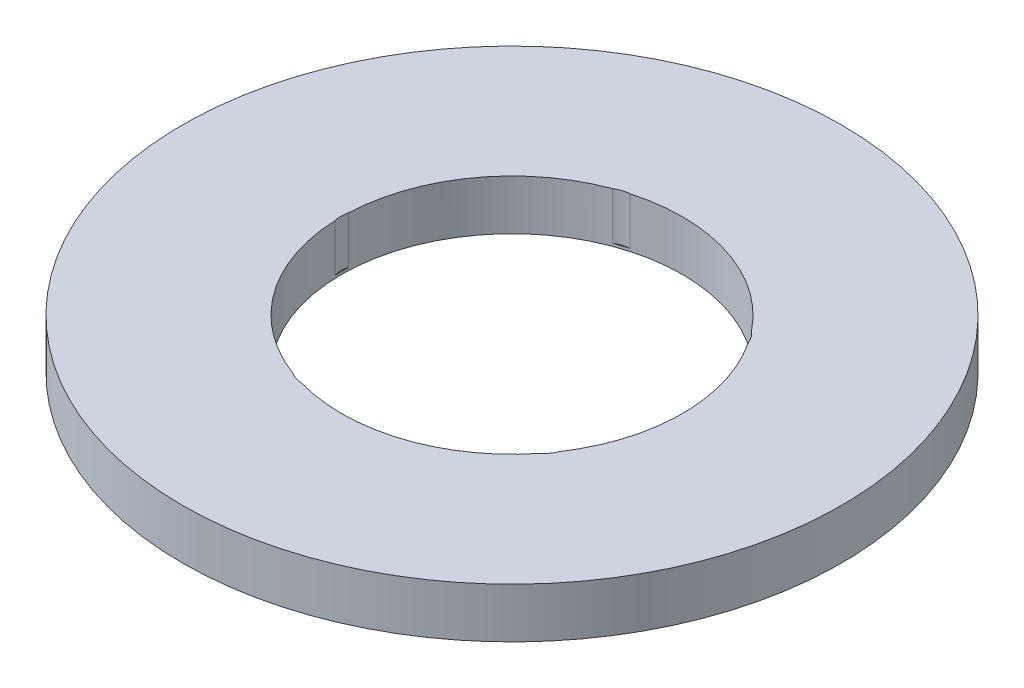
from build123d import *

# Parameters (mm, degrees)
SKETCH1_R           = 72.5
BOSS_EXTRUDE1_DEPTH = 11
SKETCH2_R           = 37.5
CUT_EXTRUDE1_DEPTH  = 104.118863454
SKETCH3_R           = 6.078389282
CUT_EXTRUDE2_DEPTH  = 10.405644439
CIRPATTERN1_COUNT   = 5


with BuildPart() as part:
    # Sketch1 → Boss-Extrude1 (new body)
    with BuildSketch(Plane(origin=(0, 0, 0), x_dir=(1, 0, 0), z_dir=(0, 1, 0))):
        Circle(SKETCH1_R)
    extrude(amount=BOSS_EXTRUDE1_DEPTH)

    # Sketch2 → Cut-Extrude1 (cut, through all)
    with BuildSketch(Plane(origin=(0, 0, 0), x_dir=(1, 0, 0), z_dir=(0, 1, 0))):
        Circle(SKETCH2_R)
    extrude(amount=CUT_EXTRUDE1_DEPTH, mode=Mode.SUBTRACT)

    # Sketch3 → Cut-Extrude2 (cut)
    with BuildSketch(Plane(origin=(0, 11, 0), x_dir=(1, 0, 0), z_dir=(0, 1, 0))):
        with Locations((-31.583891439, 0)):
            Circle(SKETCH3_R)
    cut_extrude2 = extrude(amount=-CUT_EXTRUDE2_DEPTH, mode=Mode.SUBTRACT)

    # CirPattern1: Cut-Extrude2 ×5 about axis
    cirpattern1_axis = Axis((0, 0, 0), (0, 1, 0))
    for i in range(1, CIRPATTERN1_COUNT):
        add(cut_extrude2.rotate(cirpattern1_axis, i * 360 / CIRPATTERN1_COUNT), mode=Mode.SUBTRACT)


solid = part.part
